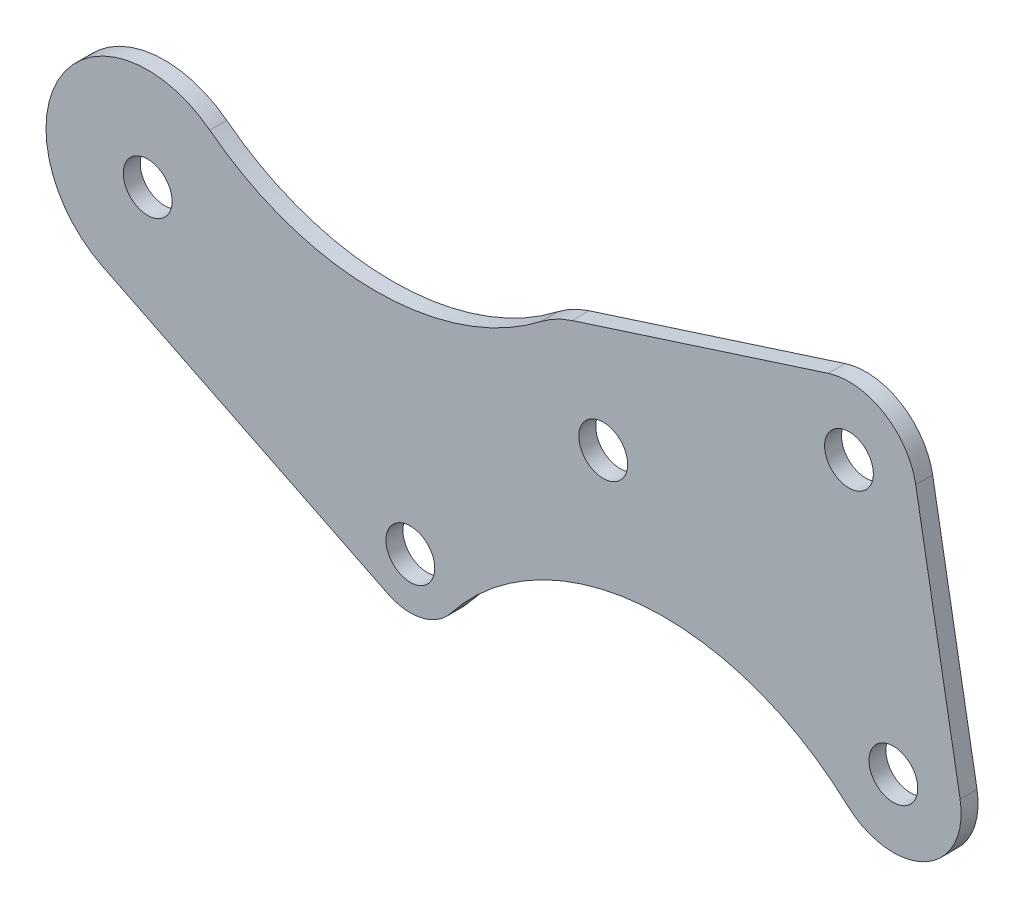
from build123d import *

# Parameters (mm, degrees)
SKETCH1_R           = 2.286
BOSS_EXTRUDE1_DEPTH = 1.5875


with BuildPart() as part:
    # Sketch1 → Boss-Extrude1 (new body)
    with BuildSketch(Plane.XY):
        with BuildLine():
            Line((-4.21740813, -8.540438728), (22.497545935, -21.732719364))
            ThreePointArc((22.497545935, -21.732719364), (25.663194561, -22.106234967), (28.355351823, -20.399444291))
            ThreePointArc((28.355351823, -20.399444291), (46.290384539, -10.746834835), (65.550112309, -17.372629436))
            ThreePointArc((65.550112309, -17.372629436), (72.901346313, -18.268822647), (76.102355552, -11.590698397))
            Line((76.102355552, -11.590698397), (71.944573343, 11.843805451))
            ThreePointArc((71.944573343, 11.843805451), (68.968405452, 16.174089716), (63.749022006, 16.779873162))
            Line((63.749022006, 16.779873162), (39.757206323, 9.068053971))
            ThreePointArc((39.757206323, 9.068053971), (38.238896923, 8.430493586), (36.853090909, 7.540949674))
            ThreePointArc((36.853090909, 7.540949674), (21.336, 2.250148806), (5.818909091, 7.540949674))
            ThreePointArc((5.818909091, 7.540949674), (-8.080468091, 5.042981304), (-4.21740813, -8.540438728))
        make_face()
        Circle(SKETCH1_R, mode=Mode.SUBTRACT)
        with Locations((42.672, 0)):
            Circle(SKETCH1_R, mode=Mode.SUBTRACT)
        with Locations((65.692217791, 10.734503848)):
            Circle(SKETCH1_R, mode=Mode.SUBTRACT)
        with Locations((24.60625, -17.4625)):
            Circle(SKETCH1_R, mode=Mode.SUBTRACT)
        with Locations((69.85, -12.7)):
            Circle(SKETCH1_R, mode=Mode.SUBTRACT)
    extrude(amount=BOSS_EXTRUDE1_DEPTH)


solid = part.part
